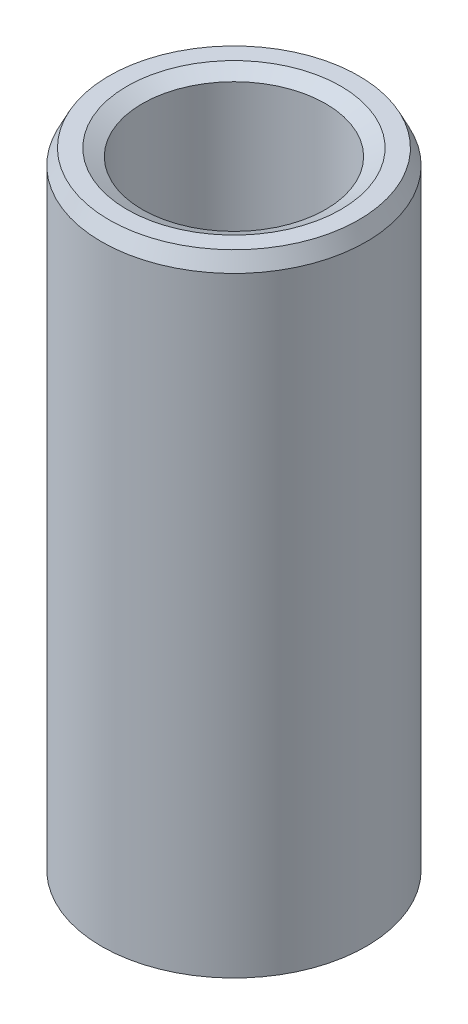
from build123d import *
from OCP.BRepFilletAPI import BRepFilletAPI_MakeChamfer

# Parameters (mm, degrees)
SKETCH1_R           = 10
BOSS_EXTRUDE1_DEPTH = 47.814967119
SKETCH2_R           = 6.927876871
CUT_EXTRUDE1_DEPTH  = 50.862521803
CHAMFER1_SIZE       = 1.147439897
CHAMFER1_SIZE2      = 0.570552783


with BuildPart() as part:
    # Sketch1 → Boss-Extrude1 (new body)
    with BuildSketch(Plane(origin=(0, 0, 0), x_dir=(1, 0, 0), z_dir=(0, 1, 0))):
        Circle(SKETCH1_R)
    extrude(amount=BOSS_EXTRUDE1_DEPTH)

    # Sketch2 → Cut-Extrude1 (cut, through all)
    with BuildSketch(Plane(origin=(0, 0, 0), x_dir=(1, 0, 0), z_dir=(0, 1, 0))):
        Circle(SKETCH2_R)
    extrude(amount=CUT_EXTRUDE1_DEPTH, mode=Mode.SUBTRACT)

    # Chamfer1: one chamfer whose edges measure the first distance from different faces: ONE call of the kernel's chamfer builder (chamfer() names one face for all edges)
    chamfer1_edges_1 = [part.edges().sort_by_distance(p)[0] for p in [
        (-6.927876871, 47.814967119, 0),
    ]]
    chamfer1_side_1 = [part.faces().sort_by_distance(p)[0] for p in [
        (-9.717157288, 47.814967119, 0),
    ]]
    chamfer1_edges_2 = [part.edges().sort_by_distance(p)[0] for p in [
        (-6.927876871, 0, 0),
    ]]
    chamfer1_side_2 = [part.faces().sort_by_distance(p)[0] for p in [
        (-6.927876871, 23.907483559, 0),
    ]]
    chamfer1_edges_3 = [part.edges().sort_by_distance(p)[0] for p in [
        (-10, 0, 0),
    ]]
    chamfer1_side_3 = [part.faces().sort_by_distance(p)[0] for p in [
        (-9.717157288, 0, 0),
    ]]
    chamfer1_edges_4 = [part.edges().sort_by_distance(p)[0] for p in [
        (-10, 47.814967119, 0),
    ]]
    chamfer1_side_4 = [part.faces().sort_by_distance(p)[0] for p in [
        (-10, 23.907483559, 0),
    ]]
    chamfer1 = BRepFilletAPI_MakeChamfer(part.part.solid().wrapped)
    for e in chamfer1_edges_1:
        chamfer1.Add(CHAMFER1_SIZE, CHAMFER1_SIZE2, e.wrapped, chamfer1_side_1[0].wrapped)  # the first distance lies on this face
    for e in chamfer1_edges_2:
        chamfer1.Add(CHAMFER1_SIZE, CHAMFER1_SIZE2, e.wrapped, chamfer1_side_2[0].wrapped)  # the first distance lies on this face
    for e in chamfer1_edges_3:
        chamfer1.Add(CHAMFER1_SIZE, CHAMFER1_SIZE2, e.wrapped, chamfer1_side_3[0].wrapped)  # the first distance lies on this face
    for e in chamfer1_edges_4:
        chamfer1.Add(CHAMFER1_SIZE, CHAMFER1_SIZE2, e.wrapped, chamfer1_side_4[0].wrapped)  # the first distance lies on this face
    add(Compound.cast(chamfer1.Shape()), mode=Mode.REPLACE)


solid = part.part
